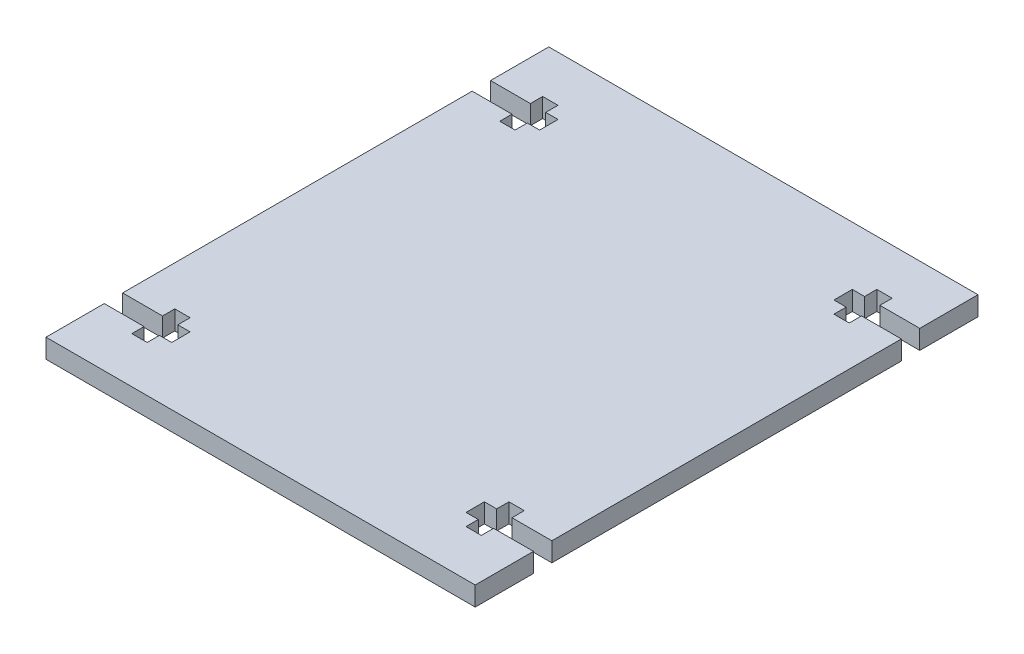
from build123d import *

# Parameters (mm, degrees)
BOSS_EXTRUDE1_DEPTH  = 1.5625
MIRROR4_COPY_1_DEPTH = 1.5625
MIRROR4_COPY_2_DEPTH = 1.5625


with BuildPart() as part:
    # Sketch1 → Boss-Extrude1 (new, symmetric)
    with BuildSketch(Plane(origin=(0, 0, 0), x_dir=(1, 0, 0), z_dir=(0, 1, 0))):
        Polygon((0, 41), (35, 41), (35, 31.5), (28.5, 31.5), (28.5, 33.5), (26, 33.5), (26, 31.5), (24, 31.5), (24, 28.5), (26, 28.5), (26, 26.5), (28.5, 26.5), (28.5, 28.5), (35, 28.5), (35, 0), (0, 0), align=None)
    boss_extrude1 = extrude(amount=BOSS_EXTRUDE1_DEPTH, both=True)

    # Mirror1: Boss-Extrude1 across plane
    add(boss_extrude1.mirror(Plane(origin=(0, 0, 0), x_dir=(0, 0, 1), z_dir=(1, 0, 0))))

    # Mirror4 copy 1 sketch → Mirror4 copy 1 (add, symmetric)
    with BuildSketch(Plane(origin=(0, 0, 0), x_dir=(-1, 0, 0), z_dir=(0, 1, 0))):
        Polygon((0, 41), (35, 41), (35, 31.5), (28.5, 31.5), (28.5, 33.5), (26, 33.5), (26, 31.5), (24, 31.5), (24, 28.5), (26, 28.5), (26, 26.5), (28.5, 26.5), (28.5, 28.5), (35, 28.5), (35, 0), (0, 0), align=None)
    extrude(amount=MIRROR4_COPY_1_DEPTH, both=True)

    # Mirror4 copy 2 sketch → Mirror4 copy 2 (add, symmetric)
    with BuildSketch(Plane(origin=(0, 0, 0), x_dir=(1, 0, 0), z_dir=(0, 1, 0))):
        Polygon((0, -41), (35, -41), (35, -31.5), (28.5, -31.5), (28.5, -33.5), (26, -33.5), (26, -31.5), (24, -31.5), (24, -28.5), (26, -28.5), (26, -26.5), (28.5, -26.5), (28.5, -28.5), (35, -28.5), (35, 0), (0, 0), align=None)
    extrude(amount=MIRROR4_COPY_2_DEPTH, both=True)


solid = part.part
